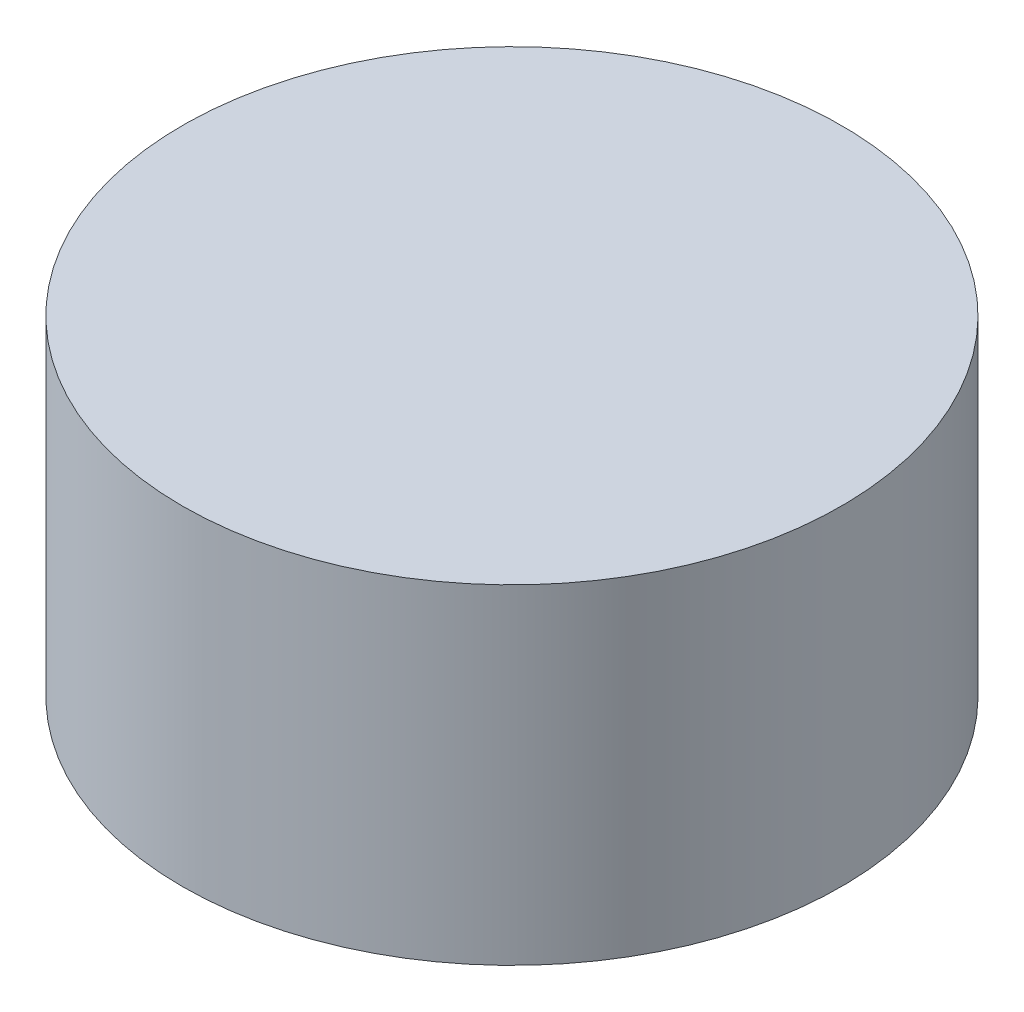
from build123d import *

# Parameters (mm, degrees)
SKETCH_1_R      = 60
EXTRUDE_1_DEPTH = 60


with BuildPart() as part:
    # 草图1 → 凸台-拉伸1 (new body)
    with BuildSketch(Plane(origin=(0, 0, 0), x_dir=(1, 0, 0), z_dir=(0, 1, 0))):
        Circle(SKETCH_1_R)
    extrude(amount=EXTRUDE_1_DEPTH)


solid = part.part
